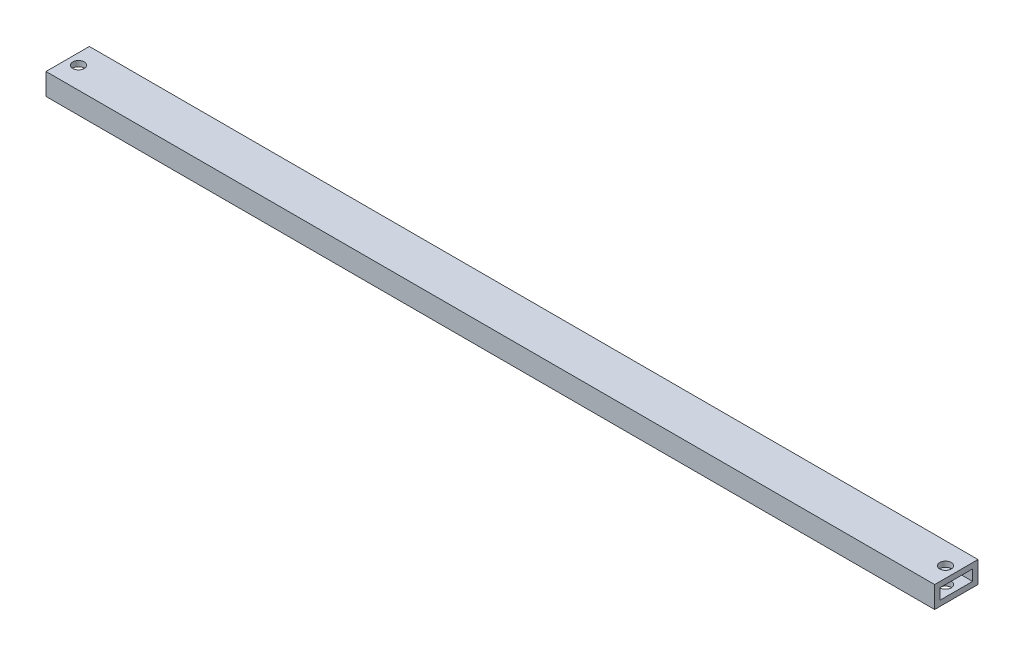
from build123d import *

# Parameters (mm, degrees)
SKETCH1_W           = 25.4
SKETCH1_H           = 12.7
SKETCH1_W_2         = 19.05
SKETCH1_H_2         = 6.35
BOSS_EXTRUDE1_DEPTH = 520.7
SKETCH2_R           = 3.3528
CUT_EXTRUDE1_DEPTH  = 522.473815258


with BuildPart() as part:
    # Sketch1 → Boss-Extrude1 (new body)
    with BuildSketch(Plane(origin=(0, 0, 0), x_dir=(0, 0, -1), z_dir=(1, 0, 0))):
        with Locations((12.7, 6.35)):
            Rectangle(SKETCH1_W, SKETCH1_H)
        with Locations((12.7, 6.35)):
            Rectangle(SKETCH1_W_2, SKETCH1_H_2, mode=Mode.SUBTRACT)
    extrude(amount=BOSS_EXTRUDE1_DEPTH)

    # Sketch2 → Cut-Extrude1 (cut, through all)
    with BuildSketch(Plane(origin=(0, 12.7, 0), x_dir=(1, 0, 0), z_dir=(0, 1, 0))):
        with Locations((6.35, 12.7)):
            Circle(SKETCH2_R)
        with Locations((514.35, 12.7)):
            Circle(SKETCH2_R)
    extrude(amount=-CUT_EXTRUDE1_DEPTH, mode=Mode.SUBTRACT)


solid = part.part
